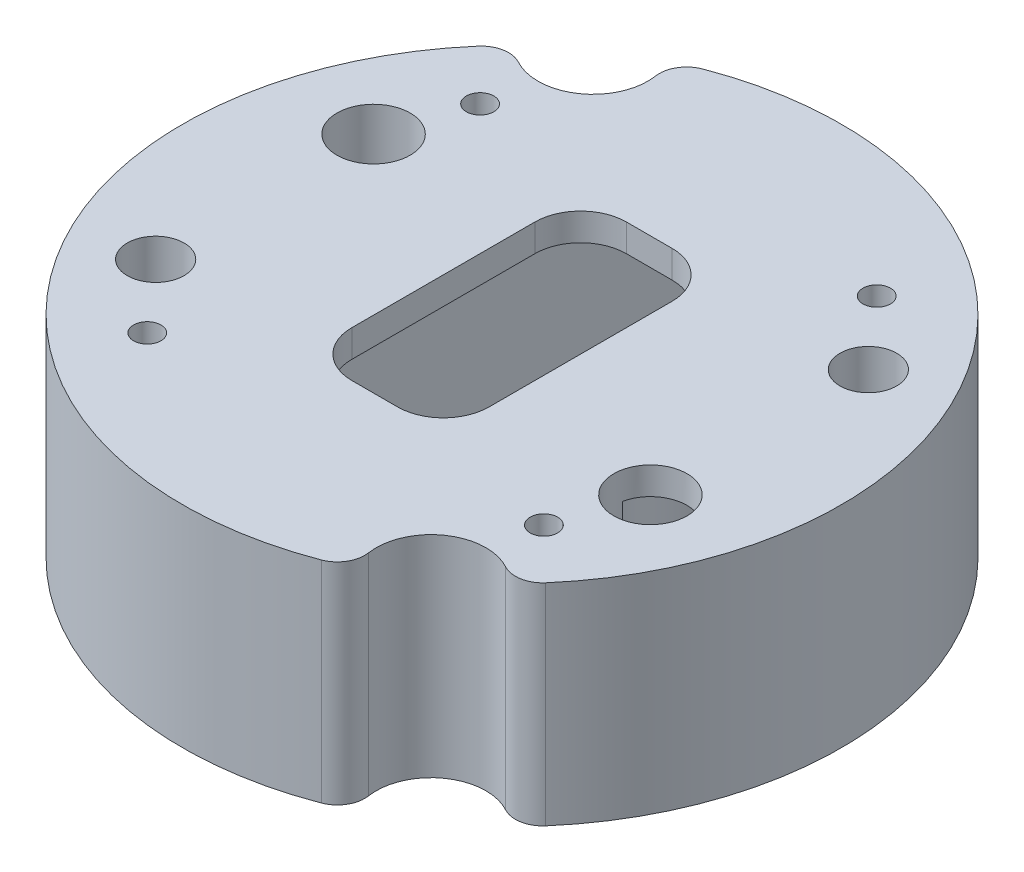
from build123d import *

# Parameters (mm, degrees)
BOSS_EXTRUDE1_OUTLINE_R   = 36
BOSS_EXTRUDE1_OUTLINE_R_2 = 9.5
BOSS_EXTRUDE1_OUTLINE_W   = 16
BOSS_EXTRUDE1_OUTLINE_H   = 68.6
BOSS_EXTRUDE1_DEPTH       = 20
SKETCH4_R                 = 3.999999999999999
CUT_EXTRUDE6_DEPTH        = 55.699177324709375
SKETCH5_R                 = 1.5000000000000009
CUT_EXTRUDE2_DEPTH        = 20
CUT_EXTRUDE4_DEPTH        = 55.699177324709375
CUT_EXTRUDE4_DEPTH_BACK   = 55.699177324709375
SKETCH6_R                 = 3.0999999999999988
CUT_EXTRUDE5_DEPTH        = 55.699177324709375
CUT_EXTRUDE5_DEPTH_BACK   = 55.699177324709375
BOSS_EXTRUDE2_OUTLINE_R   = 1.5
BOSS_EXTRUDE2_OUTLINE_R_2 = 3.1
BOSS_EXTRUDE2_OUTLINE_W   = 16
BOSS_EXTRUDE2_OUTLINE_H   = 68.6
BOSS_EXTRUDE2_OUTLINE_R_3 = 4
BOSS_EXTRUDE2_DEPTH       = 3
SKETCH9_3_W               = 16
SKETCH9_3_H               = 68.6
SKETCH9_3_W_2             = 15
SKETCH9_3_H_2             = 30
BOSS_EXTRUDE3_DEPTH       = 3
CIRPATTERN1_DEPTH         = 23
FILLET1_R                 = 5
FILLET2_R                 = 3


# Read off the part's stored shape, not the designer's step: Boss-Extrude1, Boss-Extrude2, CirPattern1
with BuildPart() as part:
    # Boss-Extrude1 outline → Boss-Extrude1 (new body)
    with BuildSketch(Plane(origin=(0, 0, 0), x_dir=(1, 0, 0), z_dir=(0, 1, 0))):
        Circle(BOSS_EXTRUDE1_OUTLINE_R)
        with Locations((-24.625, 0)):
            Circle(BOSS_EXTRUDE1_OUTLINE_R_2, mode=Mode.SUBTRACT)
        Rectangle(BOSS_EXTRUDE1_OUTLINE_W, BOSS_EXTRUDE1_OUTLINE_H, mode=Mode.SUBTRACT)
        with Locations((24.625, 0)):
            Circle(BOSS_EXTRUDE1_OUTLINE_R_2, mode=Mode.SUBTRACT)
    extrude(amount=BOSS_EXTRUDE1_DEPTH)

    # Sketch4 → Cut-Extrude6 (cut, through all)
    with BuildSketch(Plane(origin=(0, 20, 0), x_dir=(1, 0, 0), z_dir=(0, 1, 0))):
        with Locations((-24.625, 9.500000000000002)):
            Circle(SKETCH4_R)
        with Locations((24.625, -9.500000000000002)):
            Circle(SKETCH4_R)
    extrude(amount=-CUT_EXTRUDE6_DEPTH, mode=Mode.SUBTRACT)

    # Sketch5 → Cut-Extrude2 (cut)
    with BuildSketch(Plane(origin=(0, 20, 0), x_dir=(1, 0, 0), z_dir=(0, 1, 0))):
        with Locations(Location((-21.667008816788154, 18.18077910688168, 0), (0, 0, 270))):
            Circle(SKETCH5_R)
        with Locations(Location((18.180779106881676, 21.667008816788137, 0), (0, 0, 270))):
            Circle(SKETCH5_R)
        with Locations(Location((-18.18077910688169, -21.66700881678815, 0), (0, 0, 270))):
            Circle(SKETCH5_R)
        with Locations(Location((21.667008816788147, -18.180779106881687, 0), (0, 0, 270))):
            Circle(SKETCH5_R)
    extrude(amount=-CUT_EXTRUDE2_DEPTH, mode=Mode.SUBTRACT)

    # Sketch6 → Cut-Extrude4 (cut, two sides: drawn at the far end of the back side and taken through both)
    with BuildSketch(Plane(origin=(0, 20, 0), x_dir=(1, 0, 0), z_dir=(0, 1, 0)).offset(-CUT_EXTRUDE4_DEPTH_BACK)):
        with Locations(Location((-24.68172400785648, -14.250000000000037, 0), (0, 0, 270))):
            Circle(SKETCH6_R)
        with Locations(Location((24.68172400785648, 14.25000000000004, 0), (0, 0, 270))):
            Circle(SKETCH6_R)
    extrude(amount=CUT_EXTRUDE4_DEPTH + CUT_EXTRUDE4_DEPTH_BACK, mode=Mode.SUBTRACT)

    # Sketch7 → Cut-Extrude5 (cut, two sides: drawn at the far end of the back side and taken through both)
    with BuildSketch(Plane(origin=(0, 20, 0), x_dir=(1, 0, 0), z_dir=(0, 1, 0)).offset(-CUT_EXTRUDE5_DEPTH_BACK)):
        with BuildLine():
            ThreePointArc((-25.25978035738815, 25.650409281266985), (-17.20729309053125, 24.574561328669844), (-15.46414662353581, 32.50938586325165))
            ThreePointArc((-15.46414662353581, 32.50938586325165), (-20.64875170863751, 29.48947359440382), (-25.25978035738815, 25.650409281266985))
        make_face()
    extrude(amount=CUT_EXTRUDE5_DEPTH + CUT_EXTRUDE5_DEPTH_BACK, mode=Mode.SUBTRACT)

    # Boss-Extrude2 outline → Boss-Extrude2 (add)
    with BuildSketch(Plane(origin=(0, 20, 0), x_dir=(1, 0, 0), z_dir=(0, 1, 0))):
        with BuildLine():
            ThreePointArc((-25.259780357, 25.650409281), (20.648751711, -29.489473593), (-15.464146624, 32.509385863))
            ThreePointArc((-15.464146624, 32.509385863), (-17.207293091, 24.574561329), (-25.259780357, 25.650409281))
        make_face()
        with Locations((-18.180779107, -21.667008817)):
            Circle(BOSS_EXTRUDE2_OUTLINE_R, mode=Mode.SUBTRACT)
        with Locations((-24.681724008, -14.25)):
            Circle(BOSS_EXTRUDE2_OUTLINE_R_2, mode=Mode.SUBTRACT)
        Rectangle(BOSS_EXTRUDE2_OUTLINE_W, BOSS_EXTRUDE2_OUTLINE_H, mode=Mode.SUBTRACT)
        with Locations((21.667008817, -18.180779107)):
            Circle(BOSS_EXTRUDE2_OUTLINE_R, mode=Mode.SUBTRACT)
        with Locations((24.625, -9.5)):
            Circle(BOSS_EXTRUDE2_OUTLINE_R_3, mode=Mode.SUBTRACT)
        with Locations((-24.625, 9.5)):
            Circle(BOSS_EXTRUDE2_OUTLINE_R_3, mode=Mode.SUBTRACT)
        with Locations((-21.667008817, 18.180779107)):
            Circle(BOSS_EXTRUDE2_OUTLINE_R, mode=Mode.SUBTRACT)
        with Locations((24.681724008, 14.25)):
            Circle(BOSS_EXTRUDE2_OUTLINE_R_2, mode=Mode.SUBTRACT)
        with Locations((18.180779107, 21.667008817)):
            Circle(BOSS_EXTRUDE2_OUTLINE_R, mode=Mode.SUBTRACT)
    extrude(amount=BOSS_EXTRUDE2_DEPTH)

    # Sketch9<3> → Boss-Extrude3 (add)
    with BuildSketch(Plane(origin=(0, 20, 0), x_dir=(1, 0, 0), z_dir=(0, 1, 0))):
        Rectangle(SKETCH9_3_W, SKETCH9_3_H)
        Rectangle(SKETCH9_3_W_2, SKETCH9_3_H_2, mode=Mode.SUBTRACT)
    extrude(amount=BOSS_EXTRUDE3_DEPTH)

    # CirPattern1 outline → CirPattern1 (cut)
    with BuildSketch(Plane(origin=(0, 0, 0), x_dir=(1, 0, 0), z_dir=(0, 1, 0))):
        with BuildLine():
            ThreePointArc((15.464146624, -32.509385863), (20.648751709, -29.489473594), (25.259780357, -25.650409281))
            ThreePointArc((25.259780357, -25.650409281), (17.207293091, -24.574561329), (15.464146624, -32.509385863))
        make_face()
    extrude(amount=CIRPATTERN1_DEPTH, mode=Mode.SUBTRACT)

    # Fillet1
    fillet1_edges = [part.edges().sort_by_distance(p)[0] for p in [
        (7.499999999999997, 21.5, -14.999999999999998),
        (7.499999999999997, 21.5, 15.000000000000002),
        (-7.500000000000003, 21.5, 15.000000000000002),
        (-7.500000000000003, 21.5, -14.999999999999998),
    ]]
    fillet(fillet1_edges, radius=FILLET1_R)

    # Fillet2
    fillet2_edges = [part.edges().sort_by_distance(p)[0] for p in [
        (25.259780357000004, 10, 25.650409281),
        (15.464146623999998, 10, 32.509385863),
        (-25.259780357388152, 10, -25.650409281266985),
        (-15.46414662353581, 10, -32.50938586325165),
    ]]
    fillet(fillet2_edges, radius=FILLET2_R)


solid = part.part
